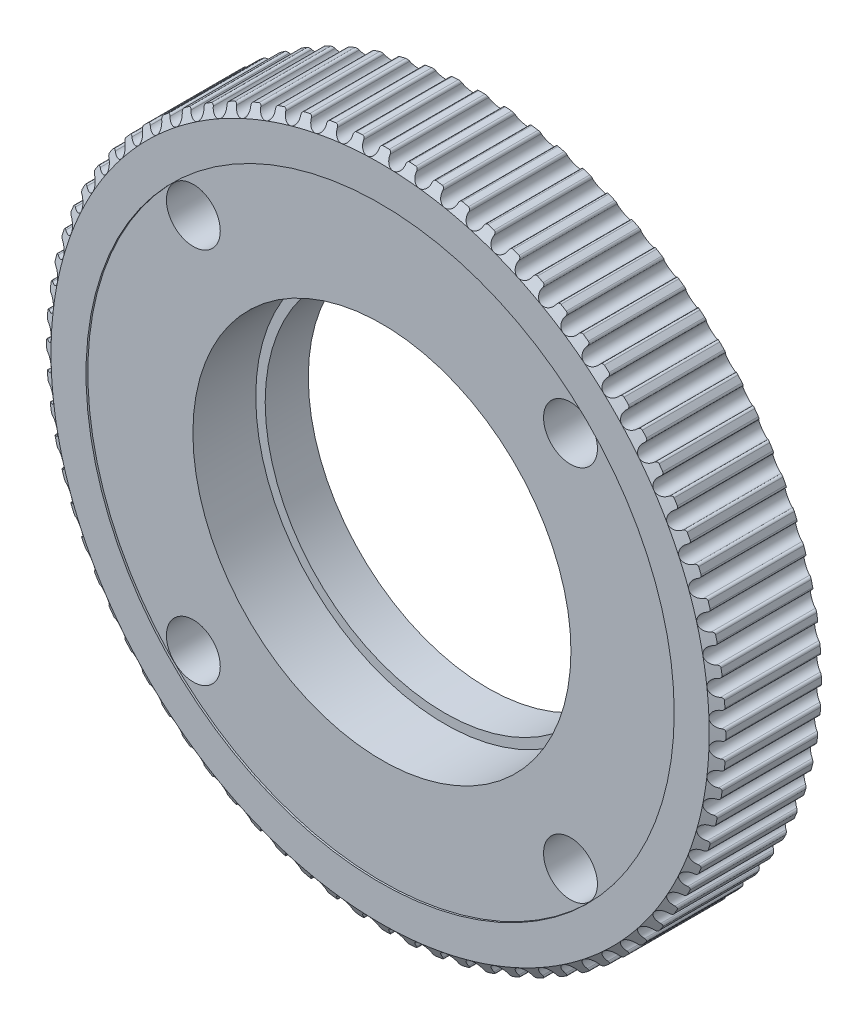
from build123d import *

# Parameters (mm, degrees)
SKETCH1_R               = 37.816186342
BOSS_EXTRUDE1_DEPTH     = 6
CUT_EXTRUDE1_DEPTH      = 55.809925186
CIRPATTERN1_COUNT       = 80
SKETCH3_R               = 21.05
CUT_EXTRUDE2_DEPTH      = 7.2
SKETCH4_R               = 20
CUT_EXTRUDE3_DEPTH      = 54.962652816
SKETCH5_OUTSIDE_W       = 123.406
SKETCH5_OUTSIDE_H       = 123.406
SKETCH5_OUTSIDE_R       = 36.646186342
CUT_EXTRUDE4_DEPTH      = 7
CUT_EXTRUDE4_DRAFT      = -60
MIRROR1_COPY_1_SKETCH_W = 123.406
MIRROR1_COPY_1_SKETCH_H = 123.406
MIRROR1_COPY_1_SKETCH_R = 36.646186342
MIRROR1_COPY_1_DEPTH    = 7
MIRROR1_COPY_1_DRAFT    = -60
SKETCH8_R               = 32.75
CUT_EXTRUDE6_DEPTH      = 0.2
SKETCH9_R               = 3
CUT_EXTRUDE7_DEPTH      = 55.766485339
CIRPATTERN2_COUNT       = 4


with BuildPart() as part:
    # Sketch1 → Boss-Extrude1 (new, symmetric)
    with BuildSketch(Plane.XY):
        Circle(SKETCH1_R)
    extrude(amount=BOSS_EXTRUDE1_DEPTH, both=True)

    # Sketch2 → Cut-Extrude1 (cut, symmetric)
    with BuildSketch(Plane.XY.offset(6)):
        with BuildLine():
            Line((-1.438722524, 36.61793346), (-1.528637401, 38.906419883))
            Line((-1.528637401, 38.906419883), (1.522303856, 38.745220419))
            Line((1.522303856, 38.745220419), (1.484656508, 37.787031433))
            Line((1.484656508, 37.787031433), (1.438722524, 36.61793346))
            ThreePointArc((1.438722524, 36.61793346), (0.828039805, 36.903239627), (0.60442476, 37.539108563))
            ThreePointArc((0.60442476, 37.539108563), (0.534949982, 37.732017499), (0.34727448, 37.814591759))
            ThreePointArc((0.34727448, 37.814591759), (0, 37.816186342), (-0.34727448, 37.814591759))
            ThreePointArc((-0.34727448, 37.814591759), (-0.534949982, 37.732017499), (-0.60442476, 37.539108563))
            ThreePointArc((-0.60442476, 37.539108563), (-0.828039805, 36.903239627), (-1.438722524, 36.61793346))
        make_face()
    cut_extrude1 = extrude(amount=CUT_EXTRUDE1_DEPTH, both=True, mode=Mode.SUBTRACT)

    # CirPattern1: Cut-Extrude1 ×80 about axis
    cirpattern1_axis = Axis((0, 0, 0), (0, 0, 1))
    for i in range(1, CIRPATTERN1_COUNT):
        add(cut_extrude1.rotate(cirpattern1_axis, i * 360 / CIRPATTERN1_COUNT), mode=Mode.SUBTRACT)

    # Sketch3 → Cut-Extrude2 (cut)
    with BuildSketch(Plane.XY.offset(6)):
        Circle(SKETCH3_R)
    extrude(amount=-CUT_EXTRUDE2_DEPTH, mode=Mode.SUBTRACT)

    # Sketch4 → Cut-Extrude3 (cut, through all)
    with BuildSketch(Plane.XY.offset(-1.2)):
        Circle(SKETCH4_R)
    extrude(amount=-CUT_EXTRUDE3_DEPTH, mode=Mode.SUBTRACT)


with BuildPart() as cut_extrude4_tool:
    # Sketch5 outside → Cut-Extrude4 (with draft: the straight prism first)
    with BuildSketch(Plane.XY.offset(6)):
        Rectangle(SKETCH5_OUTSIDE_W, SKETCH5_OUTSIDE_H)
        Circle(SKETCH5_OUTSIDE_R, mode=Mode.SUBTRACT)
    extrude(amount=-CUT_EXTRUDE4_DEPTH)
    # Cut-Extrude4: the draft: its side faces are tilted about the plane it starts from
    cut_extrude4_sides = [cut_extrude4_tool.faces().sort_by_distance(p)[0] for p in [
        (0, -61.703, 2.5),
        (61.703, 0, 2.5),
        (0, 61.703, 2.5),
        (-61.703, 0, 2.5),
        (-36.646186342, 0, 2.5),
    ]]
    draft(cut_extrude4_sides, Plane.XY.offset(6), CUT_EXTRUDE4_DRAFT)


with BuildPart() as part_1:
    add(part.part)

    # Cut-Extrude4: cut by cut_extrude4_tool
    add(cut_extrude4_tool.part, mode=Mode.SUBTRACT)


with BuildPart() as mirror1_copy_1_tool:
    # Mirror1 copy 1 sketch → Mirror1 copy 1 (with draft: the straight prism first)
    with BuildSketch(Plane(origin=(0, 0, -6), x_dir=(1, 0, 0), z_dir=(0, 0, -1))):
        Rectangle(MIRROR1_COPY_1_SKETCH_W, MIRROR1_COPY_1_SKETCH_H)
        Circle(MIRROR1_COPY_1_SKETCH_R, mode=Mode.SUBTRACT)
    extrude(amount=-MIRROR1_COPY_1_DEPTH)
    # Mirror1 copy 1: the draft: its side faces are tilted about the plane it starts from
    mirror1_copy_1_sides = [mirror1_copy_1_tool.faces().sort_by_distance(p)[0] for p in [
        (0, -61.703, -2.5),
        (61.703, 0, -2.5),
        (0, 61.703, -2.5),
        (-61.703, 0, -2.5),
        (-36.646186342, 0, -2.5),
    ]]
    draft(mirror1_copy_1_sides, Plane(origin=(0, 0, -6), x_dir=(1, 0, 0), z_dir=(0, 0, -1)), MIRROR1_COPY_1_DRAFT)


with BuildPart() as part_2:
    add(part_1.part)

    # Mirror1 copy 1: cut by mirror1_copy_1_tool
    add(mirror1_copy_1_tool.part, mode=Mode.SUBTRACT)

    # Sketch8 → Cut-Extrude6 (cut)
    with BuildSketch(Plane.XY.offset(6)):
        Circle(SKETCH8_R)
    extrude(amount=-CUT_EXTRUDE6_DEPTH, mode=Mode.SUBTRACT)

    # Sketch9 → Cut-Extrude7 (cut, through all)
    with BuildSketch(Plane.XY.offset(5.8)):
        with Locations((21, 21)):
            Circle(SKETCH9_R)
    cut_extrude7 = extrude(amount=-CUT_EXTRUDE7_DEPTH, mode=Mode.SUBTRACT)

    # CirPattern2: Cut-Extrude7 ×4 about axis
    cirpattern2_axis = Axis((0, 0, 0), (0, 0, 1))
    for i in range(1, CIRPATTERN2_COUNT):
        add(cut_extrude7.rotate(cirpattern2_axis, i * 360 / CIRPATTERN2_COUNT), mode=Mode.SUBTRACT)


solid = part_2.part
